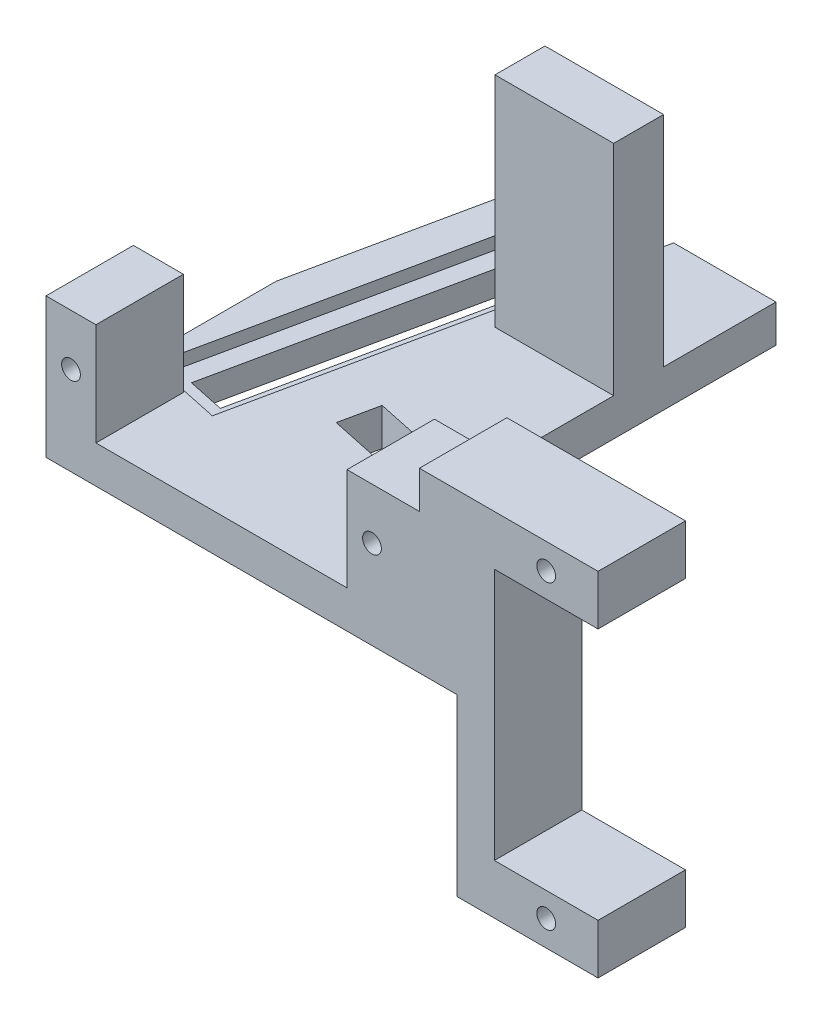
from build123d import *

# Parameters (mm, degrees)
SKETCH1_R               = 0.75
BOSS_EXTRUDE1_DEPTH     = 7
SKETCH9_W               = 32.9
SKETCH9_H               = 14
CUT_EXTRUDE1_DEPTH      = 53.894990311
SKETCH10_W              = 24.1
SKETCH10_H              = 3
BOSS_EXTRUDE2_DEPTH     = 30
CUT_EXTRUDE2_DEPTH      = 57.059254365
CUT_EXTRUDE3_DEPTH      = 57.059254365
CUT_EXTRUDE4_DEPTH      = 1
CUT_EXTRUDE5_DEPTH      = 57.059254365
BOSS_EXTRUDE4_START     = 4
BOSS_EXTRUDE4_OUTLINE_W = 19.373526859
BOSS_EXTRUDE4_OUTLINE_H = 3
BOSS_EXTRUDE4_DEPTH     = 2.47789315
SKETCH21_W              = 25.330744156
SKETCH21_H              = 3
BOSS_EXTRUDE7_DEPTH     = 4
BOSS_EXTRUDE8_START     = 14
BOSS_EXTRUDE8_DEPTH     = 3
CUT_EXTRUDE6_REACH      = 66.171
SKETCH23_W              = 6.651649707
SKETCH23_H              = 3
SKETCH24_W              = 9.5
SKETCH24_H              = 4
BOSS_EXTRUDE9_DEPTH     = 17.5


with BuildPart() as part:
    # Sketch1 → Boss-Extrude1 (new body)
    with BuildSketch(Plane.XY):
        Polygon((0, 0), (0, 25.2), (4, 25.2), (4, 17), (24.1, 17), (24.1, 25.2), (29.9, 25.2), (29.9, 28.2), (44.2, 28.2), (44.2, 24.2), (35.9, 24.2), (35.9, 4), (44.2, 4), (44.2, 0), align=None)
        with Locations((2, 21.1)):
            Circle(SKETCH1_R, mode=Mode.SUBTRACT)
        with Locations((26.1, 21.1)):
            Circle(SKETCH1_R, mode=Mode.SUBTRACT)
        with Locations((40.05, 26.15)):
            Circle(SKETCH1_R, mode=Mode.SUBTRACT)
        with Locations((40.05, 2.05)):
            Circle(SKETCH1_R, mode=Mode.SUBTRACT)
    extrude(amount=BOSS_EXTRUDE1_DEPTH)

    # Sketch9 → Cut-Extrude1 (cut, through all)
    with BuildSketch(Plane.XY.offset(7)):
        with Locations((16.45, 7)):
            Rectangle(SKETCH9_W, SKETCH9_H)
    extrude(amount=-CUT_EXTRUDE1_DEPTH, mode=Mode.SUBTRACT)

    # Sketch10 → Boss-Extrude2 (add)
    with BuildSketch(Plane(origin=(0, 0, 0), x_dir=(-1, 0, 0), z_dir=(0, 0, -1))):
        with Locations((-12.05, 15.5)):
            Rectangle(SKETCH10_W, SKETCH10_H)
    extrude(amount=BOSS_EXTRUDE2_DEPTH)

    # Sketch11 → Cut-Extrude2 (cut, through all)
    with BuildSketch(Plane(origin=(0, 17, 0), x_dir=(1, 0, 0), z_dir=(0, 1, 0))):
        Polygon((8.6, 30), (2.648416273, 2), (5.582859075, 1.376264928), (11.667021785, 30), align=None)
    extrude(amount=-CUT_EXTRUDE2_DEPTH, mode=Mode.SUBTRACT)

    # Sketch12 → Cut-Extrude3 (cut, through all)
    with BuildSketch(Plane(origin=(0, 17, 0), x_dir=(1, 0, 0), z_dir=(0, 1, 0))):
        Polygon((12.20677635, 4.027982726), (24.1, 1.5), (24.1, 4.669255844), (12.851302592, 7.060240288), align=None)
    extrude(amount=-CUT_EXTRUDE3_DEPTH, mode=Mode.SUBTRACT)

    # Sketch14 → Cut-Extrude4 (cut)
    with BuildSketch(Plane(origin=(0, 17, 0), x_dir=(1, 0, 0), z_dir=(0, 1, 0))):
        Polygon((7.015372078, 30), (0.810024371, 0.80613434), (6.776724736, -0.462126974), (13.251649707, 30), align=None)
    extrude(amount=-CUT_EXTRUDE4_DEPTH, mode=Mode.SUBTRACT)

    # Sketch15 → Cut-Extrude5 (cut, through all)
    with BuildSketch(Plane(origin=(0, 17, 0), x_dir=(1, 0, 0), z_dir=(0, 1, 0))):
        Polygon((3.948350293, 30), (0, 11.424472327), (0, 30), align=None)
    extrude(amount=-CUT_EXTRUDE5_DEPTH, mode=Mode.SUBTRACT)

    # Boss-Extrude4: read off the stored shape, not the designer's step
    # Boss-Extrude4 outline → Boss-Extrude4 (add)
    with BuildSketch(Plane(origin=(0, 0, 0), x_dir=(0.9781476007338054, 0, 0.20791169081776006), z_dir=(0.2079116908177601, 0, -0.9781476007338055)).offset(BOSS_EXTRUDE4_START)):
        with Locations((20.78932773, -15.5)):
            Rectangle(BOSS_EXTRUDE4_OUTLINE_W, BOSS_EXTRUDE4_OUTLINE_H)
    extrude(amount=BOSS_EXTRUDE4_DEPTH)

    # Sketch21 → Boss-Extrude7 (add)
    with BuildSketch(Plane(origin=(24.1, 0, 0), x_dir=(0, 0, -1), z_dir=(1, 0, 0))):
        with Locations((17.334627922, 15.5)):
            Rectangle(SKETCH21_W, SKETCH21_H)
    extrude(amount=BOSS_EXTRUDE7_DEPTH)

    # Boss-Extrude8: read off the stored shape, not the designer's step
    # Boss-Extrude8 outline → Boss-Extrude8 (add)
    with BuildSketch(Plane(origin=(0, 0, 0), x_dir=(1, 0, 0), z_dir=(0, 1, 0)).offset(BOSS_EXTRUDE8_START)):
        Polygon((24.1, 4.669255844), (28.1, 3.819029597), (28.1, 4.669255844), align=None)
    extrude(amount=BOSS_EXTRUDE8_DEPTH)

    # Cut-Extrude6: up to this plane
    cut_extrude6_end = Plane(origin=(1.991355959, 0, -9.368593205), z_dir=(0.20791169081775973, 0, -0.9781476007338056))
    # Sketch23 → Cut-Extrude6 (cut, up to the surface)
    with BuildSketch(Plane(origin=(0, 0, -30), x_dir=(-1, 0, 0), z_dir=(0, 0, -1)), mode=Mode.PRIVATE) as cut_extrude6_sk1:
        with Locations((-24.774175146, 15.5)):
            Rectangle(SKETCH23_W, SKETCH23_H)
    cut_extrude6_tool1 = split(extrude(cut_extrude6_sk1.sketch, amount=-CUT_EXTRUDE6_REACH, mode=Mode.PRIVATE), bisect_by=cut_extrude6_end, keep=Keep.BOTH, mode=Mode.PRIVATE)
    add(cut_extrude6_tool1.solids().sort_by_distance((24.774175, 15.5, -30))[0], mode=Mode.SUBTRACT)

    # Sketch24 → Boss-Extrude9 (add)
    with BuildSketch(Plane(origin=(0, 17, 0), x_dir=(1, 0, 0), z_dir=(0, 1, 0))):
        with Locations((16.698350293, 19)):
            Rectangle(SKETCH24_W, SKETCH24_H)
    extrude(amount=BOSS_EXTRUDE9_DEPTH)


solid = part.part
